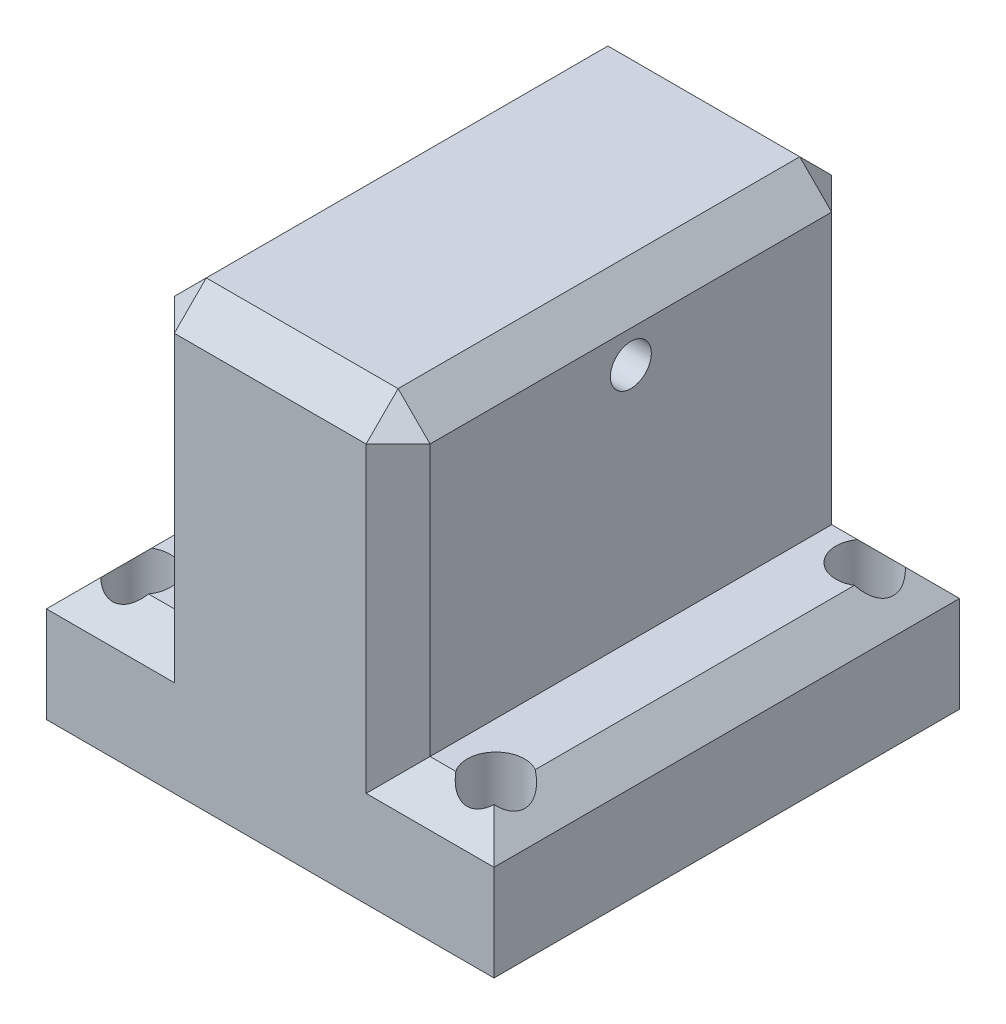
from build123d import *

# Parameters (mm, degrees)
SKETCH1_W           = 70
SKETCH1_H           = 72.813008
SKETCH1_R           = 2.6
BOSS_EXTRUDE1_DEPTH = 20
SKETCH2_R           = 4.5
CUT_EXTRUDE1_DEPTH  = 10
SKETCH3_W           = 40
SKETCH3_H           = 72.813008
BOSS_EXTRUDE2_DEPTH = 47.328226
SKETCH5_R           = 3.2
CUT_EXTRUDE2_DEPTH  = 10


with BuildPart() as part:
    # Sketch1 → Boss-Extrude1 (new body)
    with BuildSketch(Plane(origin=(0, 0, 0), x_dir=(1, 0, 0), z_dir=(0, 1, 0))):
        with Locations((35, 36.406504)):
            Rectangle(SKETCH1_W, SKETCH1_H)
        with Locations(Location((62.721774771, 65.242301259, 0), (0, 0, 270))):
            Circle(SKETCH1_R, mode=Mode.SUBTRACT)
        with Locations(Location((7.278225229, 65.242301259, 0), (0, 0, 90))):
            Circle(SKETCH1_R, mode=Mode.SUBTRACT)
        with Locations(Location((62.721774771, 7.570706741, 0), (0, 0, 90))):
            Circle(SKETCH1_R, mode=Mode.SUBTRACT)
        with Locations(Location((7.278225229, 7.570706741, 0), (0, 0, 270))):
            Circle(SKETCH1_R, mode=Mode.SUBTRACT)
    extrude(amount=BOSS_EXTRUDE1_DEPTH)

    # Sketch2 → Cut-Extrude1 (cut)
    with BuildSketch(Plane(origin=(0, 20, 0), x_dir=(1, 0, 0), z_dir=(0, 1, 0))):
        with Locations(Location((62.721774771, 65.242301259, 0), (0, 0, 270))):
            Circle(SKETCH2_R)
        with Locations(Location((7.278225229, 65.242301259, 0), (0, 0, 270))):
            Circle(SKETCH2_R)
        with Locations(Location((7.278225229, 7.570706741, 0), (0, 0, 270))):
            Circle(SKETCH2_R)
        with Locations(Location((62.721774771, 7.570706741, 0), (0, 0, 270))):
            Circle(SKETCH2_R)
    extrude(amount=-CUT_EXTRUDE1_DEPTH, mode=Mode.SUBTRACT)

    # Sketch3 → Boss-Extrude2 (add)
    with BuildSketch(Plane(origin=(0, 20, 0), x_dir=(1, 0, 0), z_dir=(0, 1, 0))):
        with Locations((35, 36.406504)):
            Rectangle(SKETCH3_W, SKETCH3_H)
    extrude(amount=BOSS_EXTRUDE2_DEPTH)

    # Sketch5 → Cut-Extrude2 (cut)
    with BuildSketch(Plane(origin=(55, 0, 0), x_dir=(0, 0, -1), z_dir=(1, 0, 0))):
        with Locations((36.406504, 57.328226)):
            Circle(SKETCH5_R)
    extrude(amount=-CUT_EXTRUDE2_DEPTH, mode=Mode.SUBTRACT)

    # Chamfer1
    # the kernel refuses this chamfer: 5 mm, written as the material it takes off along each edge
    with BuildSketch(Plane(origin=(51.666666667, 63.994892667, -3.333333333), x_dir=(0, 0.7071067811865475, -0.7071067811865475), z_dir=(0.5773502691896257, 0.5773502691896257, 0.5773502691896257)), Plane(origin=(18.333333333, 63.994892667, -3.333333333), x_dir=(-0.7071067811865475, 0, -0.7071067811865475), z_dir=(-0.5773502691896257, 0.5773502691896257, 0.5773502691896257))) as chamfer1_piece_1:
        Polygon((-3.535533906, 2.041241452), (3.535533906, 2.041241452), (0, -4.082482905), align=None)
    extrude(amount=6.350852961, mode=Mode.SUBTRACT)
    with BuildSketch(Plane(origin=(51.666666667, 63.994892667, -69.479674667), x_dir=(0, 0.7071067811865475, 0.7071067811865475), z_dir=(0.5773502691896257, 0.5773502691896257, -0.5773502691896257)), Plane(origin=(18.333333333, 63.994892667, -69.479674667), x_dir=(-0.7071067811865472, 0, 0.7071067811865478), z_dir=(-0.5773502691896258, 0.5773502691896258, -0.5773502691896255))) as chamfer1_piece_2:
        Polygon((-3.535533906, -2.041241452), (3.535533906, -2.041241452), (0, 4.082482905), align=None)
    extrude(amount=6.350852961, mode=Mode.SUBTRACT)
    with BuildSketch(Plane(origin=(70, 20, 12.85841494), x_dir=(-0.9996219169112968, 0.027495876610586282, 0), z_dir=(0, 0, -1)), Plane(origin=(15, 67.328226, 12.85841494), x_dir=(-0.027495876610586317, -0.9996219169112968, 0), z_dir=(0, 0, -1))) as chamfer1_piece_3:
        with BuildLine():
            Line((5.143365976, 0), (-0.282735774, -5.135588968))
            Line((-0.282735774, -5.135588968), (-0.382697966, -5.13283938))
            ThreePointArc((-0.382697966, -5.13283938), (-0.170646135, -2.566989148), (-0.099962192, 0.002749588))
            Line((-0.099962192, 0.002749588), (0.002749588, 0.099962192))
            ThreePointArc((0.002749588, 0.099962192), (2.572488324, 0.029278248), (5.146115564, 0.099962192))
            Line((5.146115564, 0.099962192), (5.143365976, 0))
        make_face()
    extrude(amount=98.52983788, mode=Mode.SUBTRACT)
    with BuildSketch(Plane(origin=(82.85841494, 20, -72.813008), x_dir=(0, 0.027495876610586282, 0.9996219169112968), z_dir=(-1, 0, 0)), Plane(origin=(15, 20, -72.813008), x_dir=(0, 0.027495876610586282, 0.9996219169112968), z_dir=(-1, 0, 0))) as chamfer1_piece_4:
        with BuildLine():
            Line((5.143365976, 0), (-0.282735774, -5.135588968))
            Line((-0.282735774, -5.135588968), (-0.382697966, -5.13283938))
            ThreePointArc((-0.382697966, -5.13283938), (-0.170646135, -2.566989148), (-0.099962192, 0.002749588))
            Line((-0.099962192, 0.002749588), (0.002749588, 0.099962192))
            ThreePointArc((0.002749588, 0.099962192), (2.572488324, 0.029278248), (5.146115564, 0.099962192))
            Line((5.146115564, 0.099962192), (5.143365976, 0))
        make_face()
    extrude(amount=27.85841494, mode=Mode.SUBTRACT)
    with BuildSketch(Plane(origin=(0, 20, -85.67142294), x_dir=(-0.027495876610586372, -0.9996219169112968, 0), z_dir=(0, 0, 1)), Plane(origin=(55, 67.328226, -85.67142294), x_dir=(-0.9996219169112968, 0.0274958766105877, 0), z_dir=(0, 0, 1))) as chamfer1_piece_5:
        with BuildLine():
            Line((5.143365976, 0), (-0.282735774, 5.135588968))
            Line((-0.282735774, 5.135588968), (-0.382697966, 5.13283938))
            ThreePointArc((-0.382697966, 5.13283938), (-0.170646135, 2.566989148), (-0.099962192, -0.002749588))
            Line((-0.099962192, -0.002749588), (0.002749588, -0.099962192))
            ThreePointArc((0.002749588, -0.099962192), (2.572488324, -0.029278248), (5.146115564, -0.099962192))
            Line((5.146115564, -0.099962192), (5.143365976, 0))
        make_face()
    extrude(amount=98.52983788, mode=Mode.SUBTRACT)
    with BuildSketch(Plane(origin=(55, 20, 0), x_dir=(0, -0.9996219169112968, 0.027495876610586372), z_dir=(1, 0, 0)), Plane(origin=(-12.85841494, 20, 0), x_dir=(0, -0.9996219169112968, 0.027495876610586372), z_dir=(1, 0, 0))) as chamfer1_piece_6:
        with BuildLine():
            Line((5.143365976, 0), (-0.282735774, 5.135588968))
            Line((-0.282735774, 5.135588968), (-0.382697966, 5.13283938))
            ThreePointArc((-0.382697966, 5.13283938), (-0.170646135, 2.566989148), (-0.099962192, -0.002749588))
            Line((-0.099962192, -0.002749588), (0.002749588, -0.099962192))
            ThreePointArc((0.002749588, -0.099962192), (2.572488324, -0.029278248), (5.146115564, -0.099962192))
            Line((5.146115564, -0.099962192), (5.143365976, 0))
        make_face()
    extrude(amount=27.85841494, mode=Mode.SUBTRACT)
    with BuildSketch(Plane(origin=(55, 20, 0), x_dir=(-0.9996219169112968, 0, 0.027495876610586372), z_dir=(0, 1, 0)), Plane(origin=(55, 20, -72.813008), x_dir=(0.027495876610586282, 0, 0.9996219169112968), z_dir=(0, 1, 0))) as chamfer1_piece_7:
        with BuildLine():
            Line((5.143365976, 0), (-0.282735774, -5.135588968))
            Line((-0.282735774, -5.135588968), (-0.382697966, -5.13283938))
            ThreePointArc((-0.382697966, -5.13283938), (-0.170646135, -2.566989148), (-0.099962192, 0.002749588))
            Line((-0.099962192, 0.002749588), (0.002749588, 0.099962192))
            ThreePointArc((0.002749588, 0.099962192), (2.572488324, 0.029278248), (5.146115564, 0.099962192))
            Line((5.146115564, 0.099962192), (5.143365976, 0))
        make_face()
    extrude(amount=60.18664094, mode=Mode.SUBTRACT)
    with BuildSketch(Plane(origin=(15, 20, -72.813008), x_dir=(-0.027495876610586282, 0, 0.9996219169112968), z_dir=(0, 1, 0)), Plane(origin=(15, 20, 0), x_dir=(0.9996219169112968, 0, 0.027495876610586372), z_dir=(0, 1, 0))) as chamfer1_piece_8:
        with BuildLine():
            Line((5.143365976, 0), (-0.282735774, 5.135588968))
            Line((-0.282735774, 5.135588968), (-0.382697966, 5.13283938))
            ThreePointArc((-0.382697966, 5.13283938), (-0.170646135, 2.566989148), (-0.099962192, -0.002749588))
            Line((-0.099962192, -0.002749588), (0.002749588, -0.099962192))
            ThreePointArc((0.002749588, -0.099962192), (2.572488324, -0.029278248), (5.146115564, -0.099962192))
            Line((5.146115564, -0.099962192), (5.143365976, 0))
        make_face()
    extrude(amount=60.18664094, mode=Mode.SUBTRACT)
    with BuildSketch(Plane(origin=(2.14158506, 67.328226, -72.813008), x_dir=(0, 0.027495876610587663, 0.9996219169112968), z_dir=(1, 0, 0))) as chamfer1_piece_9:
        with BuildLine():
            Line((5.143365976, 0), (-0.282735774, 5.135588968))
            Line((-0.282735774, 5.135588968), (-0.382697966, 5.13283938))
            ThreePointArc((-0.382697966, 5.13283938), (-0.170646135, 2.566989148), (-0.099962192, -0.002749588))
            Line((-0.099962192, -0.002749588), (0.002749588, -0.099962192))
            ThreePointArc((0.002749588, -0.099962192), (2.572488324, -0.029278248), (5.146115564, -0.099962192))
            Line((5.146115564, -0.099962192), (5.143365976, 0))
        make_face()
    extrude(amount=65.71682988, mode=Mode.SUBTRACT)
    with BuildSketch(Plane(origin=(67.85841494, 67.328226, 0), x_dir=(0, -0.9996219169112968, 0.027495876610586372), z_dir=(-1, 0, 0))) as chamfer1_piece_10:
        with BuildLine():
            Line((5.143365976, 0), (-0.282735774, -5.135588968))
            Line((-0.282735774, -5.135588968), (-0.382697966, -5.13283938))
            ThreePointArc((-0.382697966, -5.13283938), (-0.170646135, -2.566989148), (-0.099962192, 0.002749588))
            Line((-0.099962192, 0.002749588), (0.002749588, 0.099962192))
            ThreePointArc((0.002749588, 0.099962192), (2.572488324, 0.029278248), (5.146115564, 0.099962192))
            Line((5.146115564, 0.099962192), (5.143365976, 0))
        make_face()
    extrude(amount=65.71682988, mode=Mode.SUBTRACT)
    with BuildSketch(Plane(origin=(55, 7.14158506, -72.813008), x_dir=(0.027495876610586282, 0, 0.9996219169112968), z_dir=(0, 1, 0))) as chamfer1_piece_11a_section:
        with BuildLine():
            Line((5.143365976, 0), (-0.282735774, -5.135588968))
            Line((-0.282735774, -5.135588968), (-0.382697966, -5.13283938))
            ThreePointArc((-0.382697966, -5.13283938), (-0.170646135, -2.566989148), (-0.099962192, 0.002749588))
            Line((-0.099962192, 0.002749588), (0.002749588, 0.099962192))
            ThreePointArc((0.002749588, 0.099962192), (2.572488324, 0.029278248), (5.146115564, 0.099962192))
            Line((5.146115564, 0.099962192), (5.143365976, 0))
        make_face()
    chamfer1_piece_11a = extrude(amount=73.04505588, mode=Mode.PRIVATE)
    chamfer1_piece_11a = split(chamfer1_piece_11a, bisect_by=Plane(origin=(53.351031866, 20, -71.164039866), z_dir=(0, -1, 0)), keep=Keep.TOP, mode=Mode.PRIVATE)
    with BuildSketch(Plane(origin=(82.85841494, 20, -72.813008), x_dir=(0, 0.027495876610586282, 0.9996219169112968), z_dir=(-1, 0, 0))) as chamfer1_piece_11b_section:
        with BuildLine():
            Line((5.143365976, 0), (-0.282735774, -5.135588968))
            Line((-0.282735774, -5.135588968), (-0.382697966, -5.13283938))
            ThreePointArc((-0.382697966, -5.13283938), (-0.170646135, -2.566989148), (-0.099962192, 0.002749588))
            Line((-0.099962192, 0.002749588), (0.002749588, 0.099962192))
            ThreePointArc((0.002749588, 0.099962192), (2.572488324, 0.029278248), (5.146115564, 0.099962192))
            Line((5.146115564, 0.099962192), (5.143365976, 0))
        make_face()
    chamfer1_piece_11b = extrude(amount=40.71682988, mode=Mode.PRIVATE)
    chamfer1_piece_11b = split(chamfer1_piece_11b, bisect_by=Plane(origin=(55, 18.351031866, -71.164039866), z_dir=(-1, 0, 0)), keep=Keep.TOP, mode=Mode.PRIVATE)
    chamfer1_piece_11 = chamfer1_piece_11a & chamfer1_piece_11b
    add(chamfer1_piece_11, mode=Mode.SUBTRACT)
    with BuildSketch(Plane(origin=(55, 7.14158506, 0), x_dir=(-0.9996219169112968, 0, 0.027495876610586372), z_dir=(0, 1, 0))) as chamfer1_piece_12a_section:
        with BuildLine():
            Line((5.143365976, 0), (-0.282735774, -5.135588968))
            Line((-0.282735774, -5.135588968), (-0.382697966, -5.13283938))
            ThreePointArc((-0.382697966, -5.13283938), (-0.170646135, -2.566989148), (-0.099962192, 0.002749588))
            Line((-0.099962192, 0.002749588), (0.002749588, 0.099962192))
            ThreePointArc((0.002749588, 0.099962192), (2.572488324, 0.029278248), (5.146115564, 0.099962192))
            Line((5.146115564, 0.099962192), (5.143365976, 0))
        make_face()
    chamfer1_piece_12a = extrude(amount=73.04505588, mode=Mode.PRIVATE)
    chamfer1_piece_12a = split(chamfer1_piece_12a, bisect_by=Plane(origin=(53.351031866, 20, -1.648968134), z_dir=(0, -1, 0)), keep=Keep.TOP, mode=Mode.PRIVATE)
    with BuildSketch(Plane(origin=(42.14158506, 20, 0), x_dir=(0, -0.9996219169112968, 0.027495876610586372), z_dir=(1, 0, 0))) as chamfer1_piece_12b_section:
        with BuildLine():
            Line((5.143365976, 0), (-0.282735774, 5.135588968))
            Line((-0.282735774, 5.135588968), (-0.382697966, 5.13283938))
            ThreePointArc((-0.382697966, 5.13283938), (-0.170646135, 2.566989148), (-0.099962192, -0.002749588))
            Line((-0.099962192, -0.002749588), (0.002749588, -0.099962192))
            ThreePointArc((0.002749588, -0.099962192), (2.572488324, -0.029278248), (5.146115564, -0.099962192))
            Line((5.146115564, -0.099962192), (5.143365976, 0))
        make_face()
    chamfer1_piece_12b = extrude(amount=40.71682988, mode=Mode.PRIVATE)
    chamfer1_piece_12b = split(chamfer1_piece_12b, bisect_by=Plane(origin=(55, 18.351031866, -1.648968134), z_dir=(-1, 0, 0)), keep=Keep.TOP, mode=Mode.PRIVATE)
    chamfer1_piece_12 = chamfer1_piece_12a & chamfer1_piece_12b
    add(chamfer1_piece_12, mode=Mode.SUBTRACT)
    with BuildSketch(Plane(origin=(27.85841494, 20, -72.813008), x_dir=(0, 0.027495876610586282, 0.9996219169112968), z_dir=(-1, 0, 0))) as chamfer1_piece_13a_section:
        with BuildLine():
            Line((5.143365976, 0), (-0.282735774, -5.135588968))
            Line((-0.282735774, -5.135588968), (-0.382697966, -5.13283938))
            ThreePointArc((-0.382697966, -5.13283938), (-0.170646135, -2.566989148), (-0.099962192, 0.002749588))
            Line((-0.099962192, 0.002749588), (0.002749588, 0.099962192))
            ThreePointArc((0.002749588, 0.099962192), (2.572488324, 0.029278248), (5.146115564, 0.099962192))
            Line((5.146115564, 0.099962192), (5.143365976, 0))
        make_face()
    chamfer1_piece_13a = extrude(amount=40.71682988, mode=Mode.PRIVATE)
    chamfer1_piece_13a = split(chamfer1_piece_13a, bisect_by=Plane(origin=(15, 18.351031866, -71.164039866), z_dir=(1, 0, 0)), keep=Keep.TOP, mode=Mode.PRIVATE)
    with BuildSketch(Plane(origin=(15, 7.14158506, -72.813008), x_dir=(-0.027495876610586282, 0, 0.9996219169112968), z_dir=(0, 1, 0))) as chamfer1_piece_13b_section:
        with BuildLine():
            Line((5.143365976, 0), (-0.282735774, 5.135588968))
            Line((-0.282735774, 5.135588968), (-0.382697966, 5.13283938))
            ThreePointArc((-0.382697966, 5.13283938), (-0.170646135, 2.566989148), (-0.099962192, -0.002749588))
            Line((-0.099962192, -0.002749588), (0.002749588, -0.099962192))
            ThreePointArc((0.002749588, -0.099962192), (2.572488324, -0.029278248), (5.146115564, -0.099962192))
            Line((5.146115564, -0.099962192), (5.143365976, 0))
        make_face()
    chamfer1_piece_13b = extrude(amount=73.04505588, mode=Mode.PRIVATE)
    chamfer1_piece_13b = split(chamfer1_piece_13b, bisect_by=Plane(origin=(16.648968134, 20, -71.164039866), z_dir=(0, -1, 0)), keep=Keep.TOP, mode=Mode.PRIVATE)
    chamfer1_piece_13 = chamfer1_piece_13a & chamfer1_piece_13b
    add(chamfer1_piece_13, mode=Mode.SUBTRACT)
    with BuildSketch(Plane(origin=(-12.85841494, 20, 0), x_dir=(0, -0.9996219169112968, 0.027495876610586372), z_dir=(1, 0, 0))) as chamfer1_piece_14a_section:
        with BuildLine():
            Line((5.143365976, 0), (-0.282735774, 5.135588968))
            Line((-0.282735774, 5.135588968), (-0.382697966, 5.13283938))
            ThreePointArc((-0.382697966, 5.13283938), (-0.170646135, 2.566989148), (-0.099962192, -0.002749588))
            Line((-0.099962192, -0.002749588), (0.002749588, -0.099962192))
            ThreePointArc((0.002749588, -0.099962192), (2.572488324, -0.029278248), (5.146115564, -0.099962192))
            Line((5.146115564, -0.099962192), (5.143365976, 0))
        make_face()
    chamfer1_piece_14a = extrude(amount=40.71682988, mode=Mode.PRIVATE)
    chamfer1_piece_14a = split(chamfer1_piece_14a, bisect_by=Plane(origin=(15, 18.351031866, -1.648968134), z_dir=(1, 0, 0)), keep=Keep.TOP, mode=Mode.PRIVATE)
    with BuildSketch(Plane(origin=(15, 7.14158506, 0), x_dir=(0.9996219169112968, 0, 0.027495876610586372), z_dir=(0, 1, 0))) as chamfer1_piece_14b_section:
        with BuildLine():
            Line((5.143365976, 0), (-0.282735774, 5.135588968))
            Line((-0.282735774, 5.135588968), (-0.382697966, 5.13283938))
            ThreePointArc((-0.382697966, 5.13283938), (-0.170646135, 2.566989148), (-0.099962192, -0.002749588))
            Line((-0.099962192, -0.002749588), (0.002749588, -0.099962192))
            ThreePointArc((0.002749588, -0.099962192), (2.572488324, -0.029278248), (5.146115564, -0.099962192))
            Line((5.146115564, -0.099962192), (5.143365976, 0))
        make_face()
    chamfer1_piece_14b = extrude(amount=73.04505588, mode=Mode.PRIVATE)
    chamfer1_piece_14b = split(chamfer1_piece_14b, bisect_by=Plane(origin=(16.648968134, 20, -1.648968134), z_dir=(0, -1, 0)), keep=Keep.TOP, mode=Mode.PRIVATE)
    chamfer1_piece_14 = chamfer1_piece_14a & chamfer1_piece_14b
    add(chamfer1_piece_14, mode=Mode.SUBTRACT)


solid = part.part
